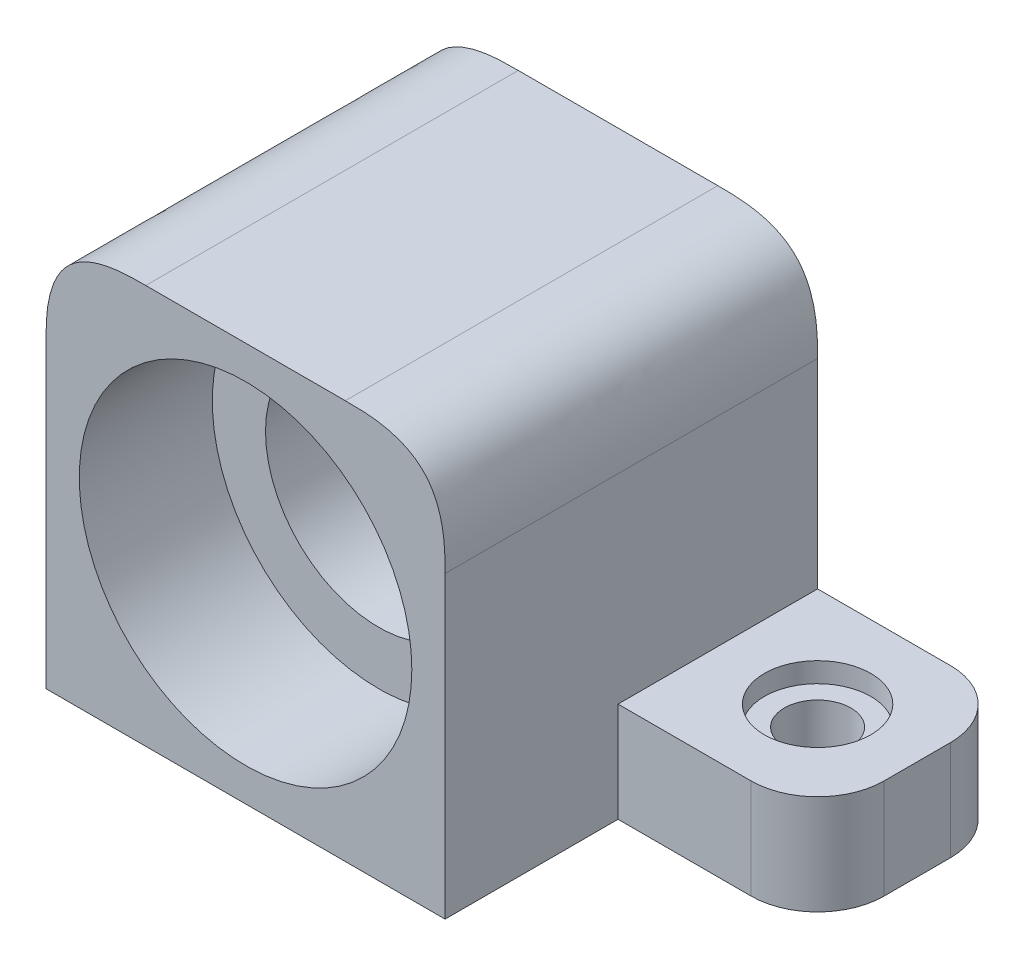
from build123d import *

# Parameters (mm, degrees)
BOSS_EXTRUDE1_DEPTH      = 20
BOSS_EXTRUDE1_DEPTH_BACK = 8
SKETCH1_W                = 30
SKETCH1_H                = 30
FILLET1_SIZE             = 7.5
SKETCH2_R                = 8.5
CUT_EXTRUDE1_DEPTH       = 60
SKETCH3_W                = 15
SKETCH3_H                = 7.5
BOSS_EXTRUDE2_DEPTH      = 15
SKETCH5_W                = 15
SKETCH5_H                = 7.5
BOSS_EXTRUDE4_DEPTH      = 15
SKETCH11_R               = 12.5
CUT_EXTRUDE3_DEPTH       = 10
SKETCH12_R               = 3.5
CUT_EXTRUDE4_DEPTH       = 10
FILLET8_R                = 5
SKETCH15_R               = 4
CUT_EXTRUDE5_DEPTH       = 1.5
SKETCH16_R               = 2.5
CUT_EXTRUDE6_DEPTH       = 12
CUT_EXTRUDE8_START       = -1.5
SKETCH18_R               = 4.25
CUT_EXTRUDE8_DEPTH       = 1.75
CUT_EXTRUDE9_START       = -5
SKETCH18_2_R             = 4.25
CUT_EXTRUDE9_DEPTH       = 1.5


with BuildPart() as part:
    # Sketch1 → Boss-Extrude1 (new, two sides: drawn at the far end of the back side and taken through both)
    with BuildSketch(Plane.XY.offset(-BOSS_EXTRUDE1_DEPTH_BACK)):
        Rectangle(SKETCH1_W, SKETCH1_H)
    extrude(amount=BOSS_EXTRUDE1_DEPTH + BOSS_EXTRUDE1_DEPTH_BACK)

    # Fillet1
    # a fillet whose section is not a circle: 7.5 mm, written as the material it takes off along each edge
    with BuildSketch(Plane(origin=(-15, 15, 38.75), x_dir=(1, 0, 0), z_dir=(0, 0, -1))) as fillet1_piece_1:
        with BuildLine():
            add(Edge.make_bspline([(FILLET1_SIZE, 0), (FILLET1_SIZE * 0.831801948466, 0), (FILLET1_SIZE * 0.663603896932, 0), (FILLET1_SIZE * 0.292893218813, FILLET1_SIZE * 0.0716919198361), (FILLET1_SIZE * 0.0716919198361, FILLET1_SIZE * 0.292893218813), (0, FILLET1_SIZE * 0.663603896932), (0, FILLET1_SIZE * 0.831801948466), (0, FILLET1_SIZE)], knots=[0, 0, 0, 0, 0, 0, 0.5, 0.5, 1, 1, 1, 1, 1, 1], degree=5))
            Line((0, FILLET1_SIZE), (0, 0))
            Line((0, 0), (FILLET1_SIZE, 0))
        make_face()
    extrude(amount=65.5, mode=Mode.SUBTRACT)
    with BuildSketch(Plane(origin=(15, 15, -26.75), x_dir=(0, -1, 0), z_dir=(0, 0, 1))) as fillet1_piece_2:
        with BuildLine():
            add(Edge.make_bspline([(FILLET1_SIZE, 0), (FILLET1_SIZE * 0.831801948466, 0), (FILLET1_SIZE * 0.663603896932, 0), (FILLET1_SIZE * 0.292893218813, -FILLET1_SIZE * 0.0716919198361), (FILLET1_SIZE * 0.0716919198361, -FILLET1_SIZE * 0.292893218813), (0, -FILLET1_SIZE * 0.663603896932), (0, -FILLET1_SIZE * 0.831801948466), (0, -FILLET1_SIZE)], knots=[0, 0, 0, 0, 0, 0, 0.5, 0.5, 1, 1, 1, 1, 1, 1], degree=5))
            Line((0, -FILLET1_SIZE), (0, 0))
            Line((0, 0), (FILLET1_SIZE, 0))
        make_face()
    extrude(amount=65.5, mode=Mode.SUBTRACT)

    # Sketch2 → Cut-Extrude1 (cut)
    with BuildSketch(Plane.XY):
        with Locations(Location((0, 0, 0), (0, 0, 180))):
            Circle(SKETCH2_R)
    extrude(amount=CUT_EXTRUDE1_DEPTH, mode=Mode.SUBTRACT)

    # Sketch3 → Boss-Extrude2 (add)
    with BuildSketch(Plane(origin=(15, 0, 0), x_dir=(0, 0, -1), z_dir=(1, 0, 0))):
        with Locations((0.5, -11.25)):
            Rectangle(SKETCH3_W, SKETCH3_H)
    extrude(amount=BOSS_EXTRUDE2_DEPTH)

    # Sketch5 → Boss-Extrude4 (add)
    with BuildSketch(Plane.ZY.offset(15)):
        with Locations((-0.5, -11.25)):
            Rectangle(SKETCH5_W, SKETCH5_H)
    extrude(amount=BOSS_EXTRUDE4_DEPTH)

    # Sketch11 → Cut-Extrude3 (cut)
    with BuildSketch(Plane.XY.offset(20)):
        Circle(SKETCH11_R)
    extrude(amount=-CUT_EXTRUDE3_DEPTH, mode=Mode.SUBTRACT)

    # Sketch12 → Cut-Extrude4 (cut)
    with BuildSketch(Plane.XY):
        with Locations((0, -3.5)):
            Circle(SKETCH12_R)
    extrude(amount=-CUT_EXTRUDE4_DEPTH, mode=Mode.SUBTRACT)

    # Fillet8
    fillet8_edges = [part.edges().sort_by_distance(p)[0] for p in [
        (30, -11.25, -8),
        (30, -11.25, 7),
        (-30, -11.25, -8),
        (-30, -11.25, 7),
    ]]
    fillet(fillet8_edges, radius=FILLET8_R)

    # Sketch15 → Cut-Extrude5 (cut)
    with BuildSketch(Plane(origin=(0, -7.5, 0), x_dir=(1, 0, 0), z_dir=(0, 1, 0))):
        with Locations(Location((22.5, 0.5, 0), (0, 0, 270))):
            Circle(SKETCH15_R)
        with Locations(Location((-22.5, 0.5, 0), (0, 0, 270))):
            Circle(SKETCH15_R)
    extrude(amount=-CUT_EXTRUDE5_DEPTH, mode=Mode.SUBTRACT)

    # Sketch16 → Cut-Extrude6 (cut)
    with BuildSketch(Plane(origin=(0, -9, 0), x_dir=(1, 0, 0), z_dir=(0, 1, 0))):
        with Locations(Location((-22.5, 0.5, 0), (0, 0, 270))):
            Circle(SKETCH16_R)
        with Locations(Location((22.5, 0.5, 0), (0, 0, 270))):
            Circle(SKETCH16_R)
    extrude(amount=-CUT_EXTRUDE6_DEPTH, mode=Mode.SUBTRACT)

    # Sketch18 → Cut-Extrude8 (cut)
    with BuildSketch(Plane.XY.offset(CUT_EXTRUDE8_START)):
        with Locations((0, -3.5)):
            Circle(SKETCH18_R)
    extrude(amount=-CUT_EXTRUDE8_DEPTH, mode=Mode.SUBTRACT)

    # Sketch18<2> → Cut-Extrude9 (cut)
    with BuildSketch(Plane.XY.offset(CUT_EXTRUDE9_START)):
        with Locations((0, -3.5)):
            Circle(SKETCH18_2_R)
    extrude(amount=-CUT_EXTRUDE9_DEPTH, mode=Mode.SUBTRACT)


solid = part.part
